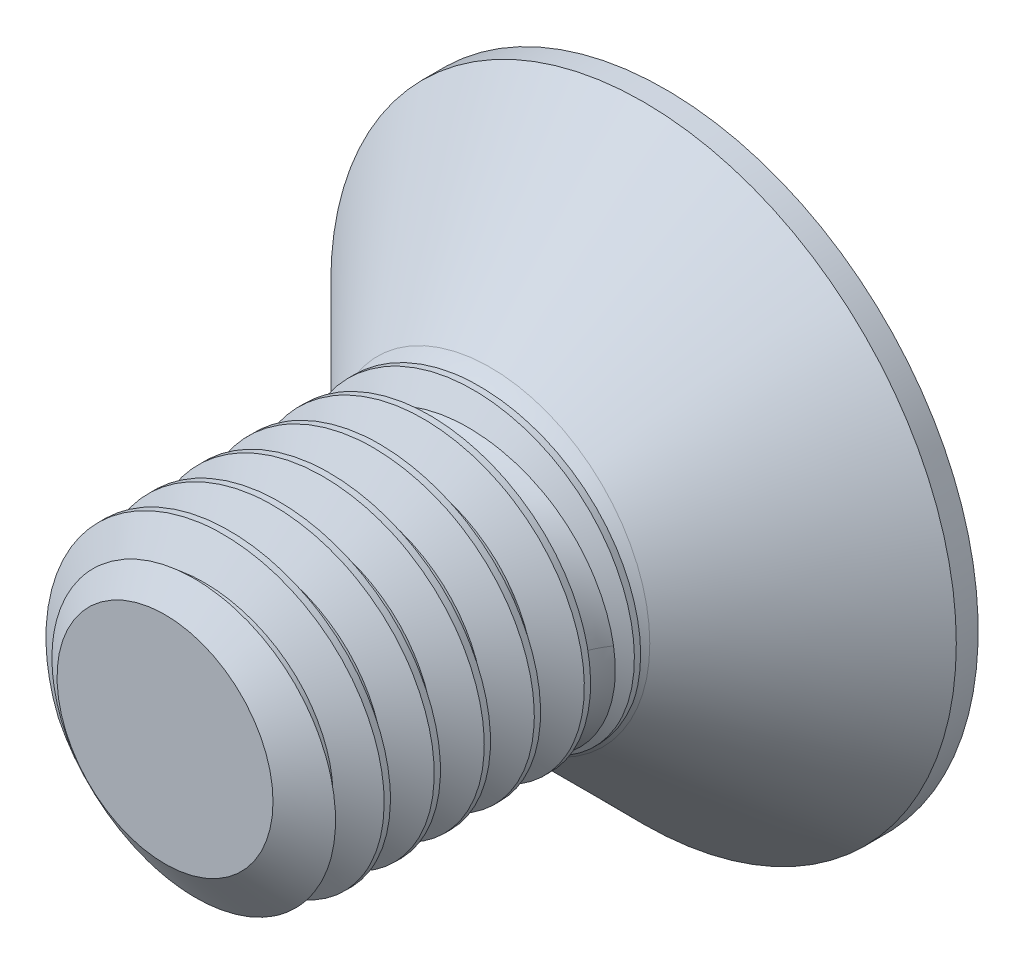
from build123d import *

# Parameters (mm, degrees)
SKETCH1_R          = 2.5
EXTRUDE1_DEPTH     = 8
CUT_SWEEP1_PITCH   = 0.8
SKETCH6_R          = 5
EXTRUDE2_DEPTH     = 2.8
CUT_EXTRUDE1_DEPTH = 2.25
SKETCH8_R          = 1.732050808
CUT_EXTRUDE2_DEPTH = 11.677078327
CUT_EXTRUDE2_TAPER = 45


with BuildPart() as part:
    # Sketch1 → Extrude1 (new body)
    with BuildSketch(Plane.XY):
        Circle(SKETCH1_R)
    extrude(amount=-EXTRUDE1_DEPTH)

    # Cut-Sweep1: the profile of Sketch3 profile screwed along a right-hand helix of 11 turns, 6 arcs to a turn; built about Z, then put on its axis
    cut_sweep1_z = Axis((0, 0, 0), (0, 0, 1))
    cut_sweep1_corners = [(2.5003, 0, -0.700173205), (1.980384758, 0, -0.4), (1.980384758, 0, -0.3), (2.5003, 0, 0.000173205)]
    with BuildLine(mode=Mode.PRIVATE) as cut_sweep1_profile:
        Line(cut_sweep1_corners[0], cut_sweep1_corners[1])
        Line(cut_sweep1_corners[1], cut_sweep1_corners[2])
        Line(cut_sweep1_corners[2], cut_sweep1_corners[3])
        Line(cut_sweep1_corners[3], cut_sweep1_corners[0])
    cut_sweep1_cap = Face(cut_sweep1_profile.wire())
    cut_sweep1_turn_angles = [0, 30, 60, 90, 120, 150, 180, 210, 240, 270, 300, 330, 360]
    cut_sweep1_turn_weights = [1, 0.8660254037844387, 1, 0.8660254037844387, 1, 0.8660254037844387, 1, 0.8660254037844387, 1, 0.8660254037844387, 1, 0.8660254037844387, 1]
    cut_sweep1_turn_rails = [Edge.make_bspline([Vector(p[0], p[1], 0).rotate(cut_sweep1_z, cut_sweep1_turn_angles[k]) / cut_sweep1_turn_weights[k] + Vector(0, 0, p[2] + CUT_SWEEP1_PITCH * cut_sweep1_turn_angles[k] / 360) for k in range(13)], [0, 0, 0, 1, 1, 2, 2, 3, 3, 4, 4, 5, 5, 6, 6, 6], 2, cut_sweep1_turn_weights) for p in cut_sweep1_corners]
    cut_sweep1_turn_sides = [Face.make_surface_from_curves(cut_sweep1_turn_rails[p[0]], cut_sweep1_turn_rails[p[1]]) for p in [(0, 1), (1, 2), (2, 3), (3, 0)]]
    cut_sweep1 = Plane(origin=(0, 0, 0), x_dir=(0, 1, 0), z_dir=(0, 0, -1)) * Solid(Shell([*[p.moved(Location((0, 0, CUT_SWEEP1_PITCH * i))) for i in range(11) for p in cut_sweep1_turn_sides], cut_sweep1_cap, cut_sweep1_cap.rotate(cut_sweep1_z, 3960).moved(Location((0, 0, CUT_SWEEP1_PITCH * 3960 / 360)))]))
    add(cut_sweep1, mode=Mode.SUBTRACT)

    # Sketch4 → Cut-Revolve1 (revolve, cut)
    with BuildSketch(Plane(origin=(0, 0, 0), x_dir=(0, 0, -1), z_dir=(1, 0, 0)), mode=Mode.PRIVATE) as cut_revolve1_sk:
        Polygon((0.541691224, 2.5), (0, 1.726384758), (0, 2.5), align=None)
    revolve(cut_revolve1_sk.sketch.rotate(Axis((0, 0, 0), (0, 0, -1)), 260.43858876), axis=Axis((0, 0, 0), (0, 0, -1)), mode=Mode.SUBTRACT)

    # Sketch6 → Extrude2 (add)
    with BuildSketch(Plane(origin=(0, 0, -8), x_dir=(-1, 0, 0), z_dir=(0, 0, -1))):
        Circle(SKETCH6_R)
    extrude(amount=-EXTRUDE2_DEPTH)

    # Sketch10 → Cut-Revolve2 (revolve, cut)
    with BuildSketch(Plane(origin=(0, 0, 0), x_dir=(0, 0, -1), z_dir=(1, 0, 0)), mode=Mode.PRIVATE) as cut_revolve2_sk:
        Polygon((7.65, -5), (5.2, -2.55), (5.2, -5), align=None)
    revolve(cut_revolve2_sk.sketch.rotate(Axis((0, 0, 0), (0, 0, -1)), 270), axis=Axis((0, 0, 0), (0, 0, -1)), mode=Mode.SUBTRACT)

    # Sketch11 → Revolve1 (revolve)
    with BuildSketch(Plane(origin=(0, 0, 0), x_dir=(0, 0, -1), z_dir=(1, 0, 0)), mode=Mode.PRIVATE) as revolve1_sk:
        with BuildLine():
            Line((3.824827157, 1.980384758), (3.824827157, 0))
            Line((3.824827157, 0), (5.2, 0))
            Line((5.2, 0), (5.2, 2.55))
            ThreePointArc((5.2, 2.55), (4.569065337, 2.128422936), (3.824827157, 1.980384758))
        make_face()
    revolve(revolve1_sk.sketch.rotate(Axis((0, 0, 0), (0, 0, -1)), 90), axis=Axis((0, 0, 0), (0, 0, -1)))

    # Sketch7 → Cut-Extrude1 (cut)
    with BuildSketch(Plane.XY.offset(-8)):
        Polygon((0, 1.732050808), (-1.5, 0.866025404), (-1.5, -0.866025404), (0, -1.732050808), (1.5, -0.866025404), (1.5, 0.866025404), align=None)
    extrude(amount=CUT_EXTRUDE1_DEPTH, mode=Mode.SUBTRACT)

    # Sketch8 → Cut-Extrude2 (cut, through all)
    with BuildSketch(Plane.XY.offset(-8)):
        Circle(SKETCH8_R)
    extrude(amount=CUT_EXTRUDE2_DEPTH, taper=CUT_EXTRUDE2_TAPER, mode=Mode.SUBTRACT)


solid = part.part
